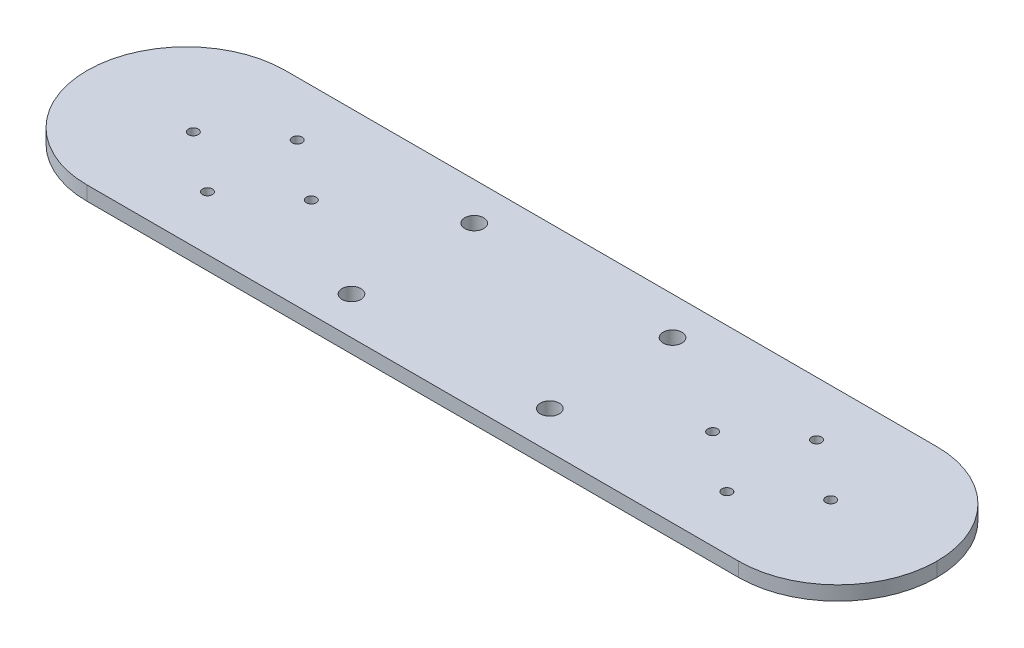
from build123d import *

# Parameters (mm, degrees)
SKETCH_1_W          = 180
SKETCH_1_H          = 3
EXTRUDE_1_DEPTH     = 21
SKETCH_2_R          = 2
CUT_EXTRUDE_1_DEPTH = 93.466210045
SKETCH_3_R          = 1.05
CUT_EXTRUDE_2_DEPTH = 93.466210045
FILLET_1_R          = 21


with BuildPart() as part:
    # 草图1 → 凸台-拉伸1 (new, symmetric)
    with BuildSketch(Plane.XY):
        Rectangle(SKETCH_1_W, SKETCH_1_H)
    extrude(amount=EXTRUDE_1_DEPTH, both=True)

    # 草图2 → 切除-拉伸1 (cut, through all)
    with BuildSketch(Plane(origin=(0, 1.5, 0), x_dir=(1, 0, 0), z_dir=(0, 1, 0))):
        with Locations(Location((-21, 13, 0), (0, 0, 270))):
            Circle(SKETCH_2_R)
        with Locations(Location((21, 13, 0), (0, 0, 270))):
            Circle(SKETCH_2_R)
        with Locations(Location((21, -13, 0), (0, 0, 270))):
            Circle(SKETCH_2_R)
        with Locations(Location((-21, -13, 0), (0, 0, 270))):
            Circle(SKETCH_2_R)
    extrude(amount=-CUT_EXTRUDE_1_DEPTH, mode=Mode.SUBTRACT)

    # 草图3 → 切除-拉伸2 (cut, through all)
    with BuildSketch(Plane(origin=(0, 1.5, 0), x_dir=(1, 0, 0), z_dir=(0, 1, 0))):
        with Locations(Location((55, 9.5, 0), (0, 0, 270))):
            Circle(SKETCH_3_R)
        with Locations(Location((55, -9.5, 0), (0, 0, 270))):
            Circle(SKETCH_3_R)
        with Locations(Location((42.5, 0, 0), (0, 0, 270))):
            Circle(SKETCH_3_R)
        with Locations(Location((67.5, 0, 0), (0, 0, 270))):
            Circle(SKETCH_3_R)
    cut_extrude_2 = extrude(amount=-CUT_EXTRUDE_2_DEPTH, mode=Mode.SUBTRACT)

    # 镜向1: 切除-拉伸2 across plane
    add(cut_extrude_2.mirror(Plane(origin=(0, 0, 0), x_dir=(0, 0, 1), z_dir=(1, 0, 0))), mode=Mode.SUBTRACT)

    # 圆角1
    fillet_1_edges = [part.edges().sort_by_distance(p)[0] for p in [
        (90, 0, 21),
        (-90, 0, 21),
        (-90, 0, -21),
        (90, 0, -21),
    ]]
    fillet(fillet_1_edges, radius=FILLET_1_R - 0.0001)  # a hair under: the kernel refuses the full size


solid = part.part
